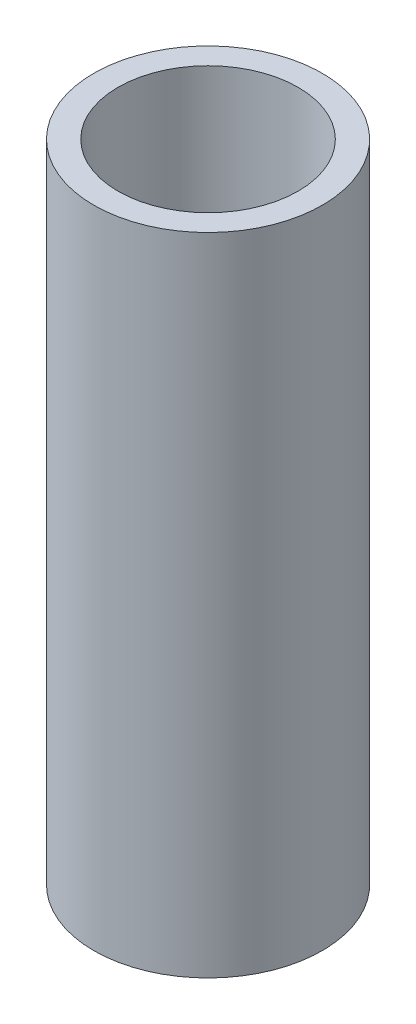
from build123d import *

# Parameters (mm, degrees)
SKETCH1_R           = 17.5
BOSS_EXTRUDE1_DEPTH = 98.873940723
SKETCH2_R           = 13.788829281
CUT_EXTRUDE1_DEPTH  = 102.924266758


with BuildPart() as part:
    # Sketch1 → Boss-Extrude1 (new body)
    with BuildSketch(Plane(origin=(0, 0, 0), x_dir=(1, 0, 0), z_dir=(0, 1, 0))):
        Circle(SKETCH1_R)
    extrude(amount=BOSS_EXTRUDE1_DEPTH)

    # Sketch2 → Cut-Extrude1 (cut, through all)
    with BuildSketch(Plane(origin=(0, 0, 0), x_dir=(1, 0, 0), z_dir=(0, 1, 0))):
        Circle(SKETCH2_R)
    extrude(amount=CUT_EXTRUDE1_DEPTH, mode=Mode.SUBTRACT)


solid = part.part
